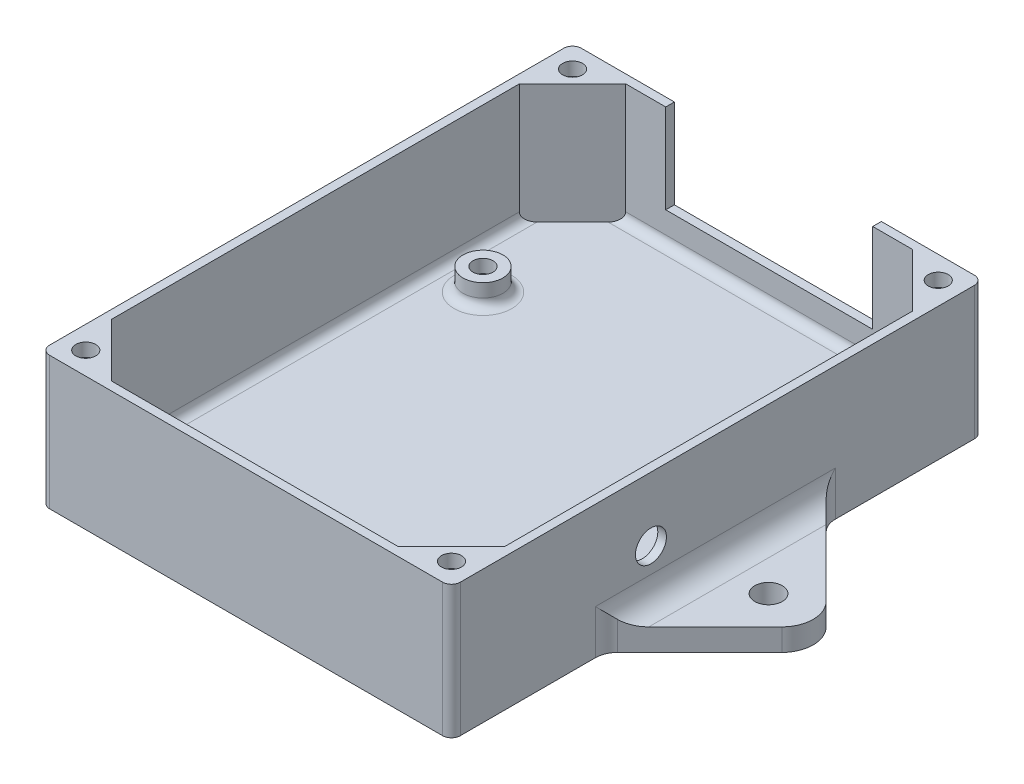
from build123d import *

# Parameters (mm, degrees)
ESQUISSE2_W              = 92.64
ESQUISSE2_H              = 119.96
ESQUISSE2_W_2            = 88.74
ESQUISSE2_H_2            = 116.06
BASE_DEPTH               = 3
ESQUISSE3_R              = 4.5
SUPPORT_PCB_DEPTH        = 5
ESQUISSE4_R              = 2.25
ESQUISSE4_R_2            = 1.5
INSERT_M3_PCB_DEPTH      = 3
ESQUISSE4_3_R            = 1.5
PASSAGE_M3_PCB_DEPTH     = 5
ESQUISSE2_4_W            = 92.64
ESQUISSE2_4_H            = 119.96
ESQUISSE2_4_W_2          = 88.74
ESQUISSE2_4_H_2          = 116.06
WALLS_DEPTH              = 27
OUVERTURE_CONN_CMC_REACH = 133.396
ESQUISSE5_W              = 46.7
ESQUISSE5_H              = 20.1
CHANFREIN1_SIZE          = 12
CONG_1_R                 = 2
ESQUISSE6_R              = 2.25
INSERT_M3_BOX_DEPTH      = 3
ESQUISSE6_3_R            = 1.6
PASSAGE_M3_BOX_DEPTH     = 18
ESQUISSE10_R             = 3.1
BOSS_EXTRU_2_DEPTH       = 5
CONG_4_R                 = 5
PASSAGE_MAP_REACH        = 134.436
ESQUISSE11_R             = 3.5


with BuildPart() as part:
    # Esquisse2 → Base (new body)
    # profile 1 of 2: a face of its own
    with BuildSketch(Plane(origin=(0, 0, 0), x_dir=(1, 0, 0), z_dir=(0, 1, 0))):
        with Locations((0, 0.45)):
            Rectangle(ESQUISSE2_W, ESQUISSE2_H)
        with Locations((0, 0.45)):
            Rectangle(ESQUISSE2_W_2, ESQUISSE2_H_2, mode=Mode.SUBTRACT)
    # profile 2 of 2: a face of its own
    with BuildSketch(Plane(origin=(0, 0, 0), x_dir=(1, 0, 0), z_dir=(0, 1, 0))):
        with Locations((0, 0.45)):
            Rectangle(ESQUISSE2_W_2, ESQUISSE2_H_2)
    extrude(amount=-BASE_DEPTH)

    # Esquisse3 → Support_PCB (add)
    with BuildSketch(Plane(origin=(0, 0, 0), x_dir=(1, 0, 0), z_dir=(0, 1, 0))):
        with Locations(Location((-34.81, 28.71, 0), (0, 0, 270))):
            Circle(ESQUISSE3_R)
        with Locations(Location((34.79, 28.71, 0), (0, 0, 270))):
            Circle(ESQUISSE3_R)
        with Locations(Location((-19.57, -48, 0), (0, 0, 90))):
            Circle(ESQUISSE3_R)
        with Locations(Location((34.79, -48, 0), (0, 0, 90))):
            Circle(ESQUISSE3_R)
    extrude(amount=SUPPORT_PCB_DEPTH)

    # Esquisse4 → Insert_M3_PCB (cut)
    # profile 1 of 8: a face of its own
    with BuildSketch(Plane(origin=(0, 5, 0), x_dir=(1, 0, 0), z_dir=(0, 1, 0))):
        with Locations(Location((-34.81, 28.71, 0), (0, 0, 270))):
            Circle(ESQUISSE4_R)
        with Locations((-34.81, 28.71)):
            Circle(ESQUISSE4_R_2, mode=Mode.SUBTRACT)
    # profile 2 of 8: a face of its own
    with BuildSketch(Plane(origin=(0, 5, 0), x_dir=(1, 0, 0), z_dir=(0, 1, 0))):
        with Locations((-34.81, 28.71)):
            Circle(ESQUISSE4_R_2)
    # profile 3 of 8: a face of its own
    with BuildSketch(Plane(origin=(0, 5, 0), x_dir=(1, 0, 0), z_dir=(0, 1, 0))):
        with Locations(Location((34.79, 28.71, 0), (0, 0, 270))):
            Circle(ESQUISSE4_R)
        with Locations((34.79, 28.71)):
            Circle(ESQUISSE4_R_2, mode=Mode.SUBTRACT)
    # profile 4 of 8: a face of its own
    with BuildSketch(Plane(origin=(0, 5, 0), x_dir=(1, 0, 0), z_dir=(0, 1, 0))):
        with Locations((34.79, 28.71)):
            Circle(ESQUISSE4_R_2)
    # profile 5 of 8: a face of its own
    with BuildSketch(Plane(origin=(0, 5, 0), x_dir=(1, 0, 0), z_dir=(0, 1, 0))):
        with Locations(Location((34.79, -48, 0), (0, 0, 270))):
            Circle(ESQUISSE4_R)
        with Locations((34.79, -48)):
            Circle(ESQUISSE4_R_2, mode=Mode.SUBTRACT)
    # profile 6 of 8: a face of its own
    with BuildSketch(Plane(origin=(0, 5, 0), x_dir=(1, 0, 0), z_dir=(0, 1, 0))):
        with Locations((34.79, -48)):
            Circle(ESQUISSE4_R_2)
    # profile 7 of 8: a face of its own
    with BuildSketch(Plane(origin=(0, 5, 0), x_dir=(1, 0, 0), z_dir=(0, 1, 0))):
        with Locations(Location((-19.57, -48, 0), (0, 0, 270))):
            Circle(ESQUISSE4_R)
        with Locations((-19.57, -48)):
            Circle(ESQUISSE4_R_2, mode=Mode.SUBTRACT)
    # profile 8 of 8: a face of its own
    with BuildSketch(Plane(origin=(0, 5, 0), x_dir=(1, 0, 0), z_dir=(0, 1, 0))):
        with Locations((-19.57, -48)):
            Circle(ESQUISSE4_R_2)
    extrude(amount=-INSERT_M3_PCB_DEPTH, mode=Mode.SUBTRACT)

    # Esquisse4<3> → Passage M3_PCB (cut)
    with BuildSketch(Plane(origin=(0, 5, 0), x_dir=(1, 0, 0), z_dir=(0, 1, 0))):
        with Locations(Location((-19.57, -48, 0), (0, 0, 270))):
            Circle(ESQUISSE4_3_R)
        with Locations(Location((34.79, -48, 0), (0, 0, 270))):
            Circle(ESQUISSE4_3_R)
        with Locations(Location((34.79, 28.71, 0), (0, 0, 270))):
            Circle(ESQUISSE4_3_R)
        with Locations(Location((-34.81, 28.71, 0), (0, 0, 270))):
            Circle(ESQUISSE4_3_R)
    extrude(amount=-PASSAGE_M3_PCB_DEPTH, mode=Mode.SUBTRACT)

    # Esquisse2<4> → Walls (add)
    with BuildSketch(Plane(origin=(0, 0, 0), x_dir=(1, 0, 0), z_dir=(0, 1, 0))):
        with Locations((0, 0.45)):
            Rectangle(ESQUISSE2_4_W, ESQUISSE2_4_H)
        with Locations((0, 0.45)):
            Rectangle(ESQUISSE2_4_W_2, ESQUISSE2_4_H_2, mode=Mode.SUBTRACT)
    extrude(amount=WALLS_DEPTH)

    # Esquisse5 → Ouverture_Conn_CMC (cut, up to next)
    with BuildSketch(Plane(origin=(0, 0, -60.43), x_dir=(-1, 0, 0), z_dir=(0, 0, -1)), mode=Mode.PRIVATE) as ouverture_conn_cmc_sk1:
        with Locations((0, 16.95)):
            Rectangle(ESQUISSE5_W, ESQUISSE5_H)
    ouverture_conn_cmc_tool1 = extrude(ouverture_conn_cmc_sk1.sketch, amount=-OUVERTURE_CONN_CMC_REACH, mode=Mode.PRIVATE) & part.part
    add(ouverture_conn_cmc_tool1.solids().sort_by_distance((0, 16.95, -60.43))[0], mode=Mode.SUBTRACT)

    # Chanfrein1
    chanfrein1_edges = [part.edges().sort_by_distance(p)[0] for p in [
        (-44.37, 13.5, -58.48),
        (44.37, 13.5, -58.48),
        (44.37, 13.5, 57.58),
        (-44.37, 13.5, 57.58),
    ]]
    chamfer(chanfrein1_edges, length=CHANFREIN1_SIZE)

    # Congé1
    # the kernel refuses this fillet: 2 mm, written as the material it adds along each edge
    with BuildSketch(Plane(origin=(-37.37, 0, -58.48), x_dir=(0, 1, 0), z_dir=(1, 0, 0)), Plane(origin=(37.37, 0, 57.58), x_dir=(0, 1, 0), z_dir=(-1, 0, 0))) as cong_1_piece_1:
        with BuildLine():
            CenterArc((CONG_1_R, CONG_1_R), CONG_1_R, 180, 90)
            Line((0, CONG_1_R), (0, 0))
            Line((0, 0), (CONG_1_R, 0))
        make_face()
    extrude(amount=74.74)
    with BuildSketch(Plane(origin=(44.37, 0, -51.48), x_dir=(0, 1, 0), z_dir=(0, 0, 1)), Plane(origin=(-44.37, 0, 50.58), x_dir=(0, 1, 0), z_dir=(0, 0, -1))) as cong_1_piece_2:
        with BuildLine():
            CenterArc((CONG_1_R, CONG_1_R), CONG_1_R, 180, 90)
            Line((0, CONG_1_R), (0, 0))
            Line((0, 0), (CONG_1_R, 0))
        make_face()
    extrude(amount=102.06)
    with BuildSketch(Plane(origin=(-34.81, 0, -28.71), x_dir=(0, 0, 1), z_dir=(-1, 0, 0))) as cong_1_piece_3:
        with BuildLine():
            CenterArc((4.5 + CONG_1_R, CONG_1_R), CONG_1_R, 180, 90)
            Line((4.5, CONG_1_R), (4.5, 0))
            Line((4.5, 0), (4.5 + CONG_1_R, 0))
        make_face()
    revolve(axis=Axis((-34.81, 0, -28.71), (0, 1, 0)))
    with BuildSketch(Plane(origin=(34.79, 0, -28.71), x_dir=(0, 0, 1), z_dir=(-1, 0, 0))) as cong_1_piece_4:
        with BuildLine():
            CenterArc((4.5 + CONG_1_R, CONG_1_R), CONG_1_R, 180, 90)
            Line((4.5, CONG_1_R), (4.5, 0))
            Line((4.5, 0), (4.5 + CONG_1_R, 0))
        make_face()
    revolve(axis=Axis((34.79, 0, -28.71), (0, 1, 0)))
    with BuildSketch(Plane(origin=(-19.57, 0, 48), x_dir=(0, 0, -1), z_dir=(1, 0, 0))) as cong_1_piece_5:
        with BuildLine():
            CenterArc((4.5 + CONG_1_R, CONG_1_R), CONG_1_R, 180, 90)
            Line((4.5, CONG_1_R), (4.5, 0))
            Line((4.5, 0), (4.5 + CONG_1_R, 0))
        make_face()
    revolve(axis=Axis((-19.57, 0, 48), (0, 1, 0)))
    with BuildSketch(Plane(origin=(34.79, 0, 48), x_dir=(0, 0, -1), z_dir=(1, 0, 0))) as cong_1_piece_6:
        with BuildLine():
            CenterArc((4.5 + CONG_1_R, CONG_1_R), CONG_1_R, 180, 90)
            Line((4.5, CONG_1_R), (4.5, 0))
            Line((4.5, 0), (4.5 + CONG_1_R, 0))
        make_face()
    revolve(axis=Axis((34.79, 0, 48), (0, 1, 0)))
    # the kernel refuses this fillet: 2 mm, written as the material it takes off along each edge
    with BuildSketch(Plane(origin=(46.32, 32, -60.43), x_dir=(-1, 0, 0), z_dir=(0, -1, 0)), Plane(origin=(46.32, 32, 59.53), x_dir=(0, 0, -1), z_dir=(0, -1, 0)), Plane(origin=(-46.32, -8, -60.43), x_dir=(1, 0, 0), z_dir=(0, 1, 0))) as cong_1_2_piece_1:
        with BuildLine():
            CenterArc((CONG_1_R, -CONG_1_R), CONG_1_R, 90, 90)
            Line((0, -CONG_1_R), (0, 0))
            Line((0, 0), (CONG_1_R, 0))
        make_face()
    extrude(amount=40, mode=Mode.SUBTRACT)
    with BuildSketch(Plane(origin=(-46.32, -8, 59.53), x_dir=(1, 0, 0), z_dir=(0, 1, 0))) as cong_1_2_piece_2:
        with BuildLine():
            CenterArc((CONG_1_R, CONG_1_R), CONG_1_R, 180, 90)
            Line((0, CONG_1_R), (0, 0))
            Line((0, 0), (CONG_1_R, 0))
        make_face()
    extrude(amount=40, mode=Mode.SUBTRACT)

    # Esquisse6 → Insert_M3_Box (cut)
    with BuildSketch(Plane(origin=(0, 27, 0), x_dir=(1, 0, 0), z_dir=(0, 1, 0))):
        with Locations(Location((-41.248784258, 55.358784258, 0), (0, 0, 270))):
            Circle(ESQUISSE6_R)
        with Locations(Location((-41.248784258, -54.458784258, 0), (0, 0, 270))):
            Circle(ESQUISSE6_R)
        with Locations(Location((41.248784258, 55.358784258, 0), (0, 0, 270))):
            Circle(ESQUISSE6_R)
        with Locations(Location((41.248784258, -54.458784258, 0), (0, 0, 270))):
            Circle(ESQUISSE6_R)
    extrude(amount=-INSERT_M3_BOX_DEPTH, mode=Mode.SUBTRACT)

    # Esquisse6<3> → Passage_M3_Box (cut)
    with BuildSketch(Plane(origin=(0, 27, 0), x_dir=(1, 0, 0), z_dir=(0, 1, 0))):
        with Locations(Location((-41.248784258, 55.358784258, 0), (0, 0, 270))):
            Circle(ESQUISSE6_3_R)
        with Locations(Location((-41.248784258, -54.458784258, 0), (0, 0, 270))):
            Circle(ESQUISSE6_3_R)
        with Locations(Location((41.248784258, 55.358784258, 0), (0, 0, 270))):
            Circle(ESQUISSE6_3_R)
        with Locations(Location((41.248784258, -54.458784258, 0), (0, 0, 270))):
            Circle(ESQUISSE6_3_R)
    extrude(amount=-PASSAGE_M3_BOX_DEPTH, mode=Mode.SUBTRACT)

    # Esquisse10 → Boss.-Extru.2 (add)
    # profile 1 of 2: a face of its own
    with BuildSketch(Plane.XZ.offset(3)):
        with BuildLine():
            Line((46.32, 25), (66.32, 5))
            ThreePointArc((66.32, 5), (68.391067812, 0), (66.32, -5))
            Line((66.32, -5), (46.32, -25))
            Line((46.32, -25), (46.32, 25))
        make_face()
        with Locations(Location((58.32, 0, 0), (0, 0, 270))):
            Circle(ESQUISSE10_R, mode=Mode.SUBTRACT)
    # profile 2 of 2: a face of its own
    with BuildSketch(Plane.XZ.offset(3)):
        with BuildLine():
            Line((-46.32, 25), (-66.32, 5))
            ThreePointArc((-66.32, 5), (-68.391067812, 0), (-66.32, -5))
            Line((-66.32, -5), (-46.32, -25))
            Line((-46.32, -25), (-46.32, 25))
        make_face()
        with Locations(Location((-58.32, 0, 0), (0, 0, 90))):
            Circle(ESQUISSE10_R, mode=Mode.SUBTRACT)
    extrude(amount=-BOSS_EXTRU_2_DEPTH)

    # Congé4
    cong_4_edges = [part.edges().sort_by_distance(p)[0] for p in [
        (46.32, 2, 0),
        (46.32, -0.5, -25),
        (46.32, -0.5, 25),
        (-46.32, 2, 0),
        (-46.32, -0.5, 25),
        (-46.32, -0.5, -25),
    ]]
    fillet(cong_4_edges, radius=CONG_4_R)

    # Esquisse11 → Passage_MAP (cut, up to next)
    with BuildSketch(Plane(origin=(46.32, 0, 0), x_dir=(0, 0, -1), z_dir=(1, 0, 0)), mode=Mode.PRIVATE) as passage_map_sk1:
        with Locations((-14.53, 12.6)):
            Circle(ESQUISSE11_R)
    passage_map_tool1 = extrude(passage_map_sk1.sketch, amount=-PASSAGE_MAP_REACH, mode=Mode.PRIVATE) & part.part
    add(passage_map_tool1.solids().sort_by_distance((46.32, 12.6, 14.53))[0], mode=Mode.SUBTRACT)


solid = part.part
